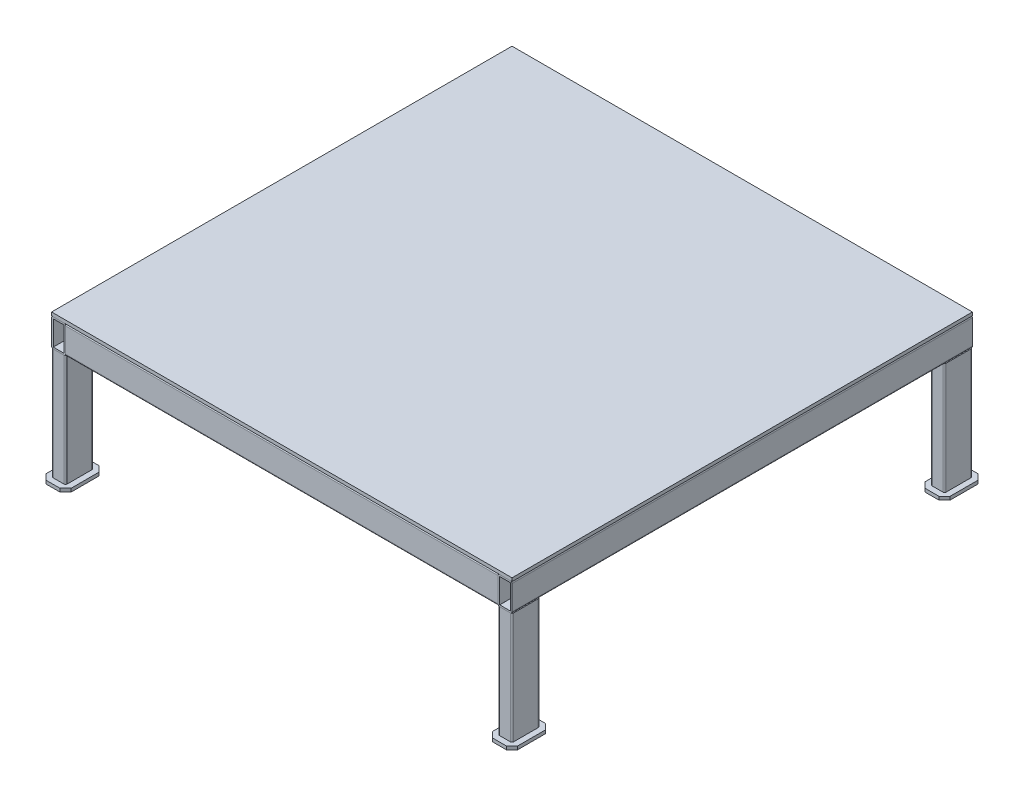
from build123d import *

# Parameters (mm, degrees)
F_50_START              = -387.5
F_50_X_25_X_3_1_DEPTH   = 775
F_50_START_2            = -412.5
F_50_X_25_X_3_1_2_DEPTH = 825
F_50_X_25_X_3_1_3_DEPTH = 825
F_50_X_25_X_3_1_4_DEPTH = 775
F_50_X_25_X_3_1_5_DEPTH = 775
F_50_X_25_X_3_6_DEPTH   = 200
SKETCH_5_W              = 825
SKETCH_5_H              = 825
EXTRUDE_1_DEPTH         = 6
SKETCH_6_W              = 45
SKETCH_6_H              = 70
EXTRUDE_2_DEPTH         = 6
CHAMFER_1_SIZE          = 10


with BuildPart() as part:
    # Прямоугольная труба 50 X 25 X 3(1): read off the stored shape, not the designer's step
    # Прямоугольная труба 50 X 25 X 3(1) outline → Прямоугольная труба 50 X 25 X 3(1) (new body)
    with BuildSketch(Plane.YZ.offset(F_50_START)):
        with BuildLine():
            ThreePointArc((21.99, 387.5), (24.118391411, 388.381608589), (25, 390.51))
            Line((25, 390.51), (25, 409.49))
            ThreePointArc((25, 409.49), (24.118391411, 411.618391411), (21.99, 412.5))
            Line((21.99, 412.5), (-21.99, 412.5))
            ThreePointArc((-21.99, 412.5), (-24.118391411, 411.618391411), (-25, 409.49))
            Line((-25, 409.49), (-25, 390.51))
            ThreePointArc((-25, 390.51), (-24.118391411, 388.381608589), (-21.99, 387.5))
            Line((-21.99, 387.5), (21.99, 387.5))
        make_face()
        with BuildLine():
            Line((-21.99, 409.5), (21.99, 409.5))
            ThreePointArc((21.99, 409.5), (21.997071068, 409.497071068), (22, 409.49))
            Line((22, 409.49), (22, 390.51))
            ThreePointArc((22, 390.51), (21.997071068, 390.502928932), (21.99, 390.5))
            Line((21.99, 390.5), (-21.99, 390.5))
            ThreePointArc((-21.99, 390.5), (-21.997071068, 390.502928932), (-22, 390.51))
            Line((-22, 390.51), (-22, 409.49))
            ThreePointArc((-22, 409.49), (-21.997071068, 409.497071068), (-21.99, 409.5))
        make_face(mode=Mode.SUBTRACT)
    extrude(amount=F_50_X_25_X_3_1_DEPTH)


with BuildPart() as body_2:
    # 50 X 25 X 3_1 2 outline → 50 X 25 X 3_1 2 (new body)
    with BuildSketch(Plane.XY.offset(F_50_START_2)):
        with BuildLine():
            ThreePointArc((-387.5, 21.99), (-388.381608589, 24.118391411), (-390.51, 25))
            Line((-390.51, 25), (-409.49, 25))
            ThreePointArc((-409.49, 25), (-411.618391411, 24.118391411), (-412.5, 21.99))
            Line((-412.5, 21.99), (-412.5, -21.99))
            ThreePointArc((-412.5, -21.99), (-411.618391411, -24.118391411), (-409.49, -25))
            Line((-409.49, -25), (-390.51, -25))
            ThreePointArc((-390.51, -25), (-388.381608589, -24.118391411), (-387.5, -21.99))
            Line((-387.5, -21.99), (-387.5, 21.99))
        make_face()
        with BuildLine():
            Line((-409.5, -21.99), (-409.5, 21.99))
            ThreePointArc((-409.5, 21.99), (-409.497071068, 21.997071068), (-409.49, 22))
            Line((-409.49, 22), (-390.51, 22))
            ThreePointArc((-390.51, 22), (-390.502928932, 21.997071068), (-390.5, 21.99))
            Line((-390.5, 21.99), (-390.5, -21.99))
            ThreePointArc((-390.5, -21.99), (-390.502928932, -21.997071068), (-390.51, -22))
            Line((-390.51, -22), (-409.49, -22))
            ThreePointArc((-409.49, -22), (-409.497071068, -21.997071068), (-409.5, -21.99))
        make_face(mode=Mode.SUBTRACT)
    extrude(amount=F_50_X_25_X_3_1_2_DEPTH)


with BuildPart() as body_3:
    # 50 X 25 X 3_1 3 outline → 50 X 25 X 3_1 3 (new body)
    with BuildSketch(Plane.XY.offset(F_50_START_2)):
        with BuildLine():
            Line((409.49, 25), (390.51, 25))
            ThreePointArc((390.51, 25), (388.381608589, 24.118391411), (387.5, 21.99))
            Line((387.5, 21.99), (387.5, -21.99))
            ThreePointArc((387.5, -21.99), (388.381608589, -24.118391411), (390.51, -25))
            Line((390.51, -25), (409.49, -25))
            ThreePointArc((409.49, -25), (411.618391411, -24.118391411), (412.5, -21.99))
            Line((412.5, -21.99), (412.5, 21.99))
            ThreePointArc((412.5, 21.99), (411.618391411, 24.118391411), (409.49, 25))
        make_face()
        with BuildLine():
            ThreePointArc((409.49, 22), (409.497071068, 21.997071068), (409.5, 21.99))
            Line((409.5, 21.99), (409.5, -21.99))
            ThreePointArc((409.5, -21.99), (409.497071068, -21.997071068), (409.49, -22))
            Line((409.49, -22), (390.51, -22))
            ThreePointArc((390.51, -22), (390.502928932, -21.997071068), (390.5, -21.99))
            Line((390.5, -21.99), (390.5, 21.99))
            ThreePointArc((390.5, 21.99), (390.502928932, 21.997071068), (390.51, 22))
            Line((390.51, 22), (409.49, 22))
        make_face(mode=Mode.SUBTRACT)
    extrude(amount=F_50_X_25_X_3_1_3_DEPTH)


with BuildPart() as body_4:
    # 50 X 25 X 3_1 4 outline → 50 X 25 X 3_1 4 (new body)
    with BuildSketch(Plane.YZ.offset(F_50_START)):
        with BuildLine():
            Line((25, -409.49), (25, -390.51))
            ThreePointArc((25, -390.51), (24.118391411, -388.381608589), (21.99, -387.5))
            Line((21.99, -387.5), (-21.99, -387.5))
            ThreePointArc((-21.99, -387.5), (-24.118391411, -388.381608589), (-25, -390.51))
            Line((-25, -390.51), (-25, -409.49))
            ThreePointArc((-25, -409.49), (-24.118391411, -411.618391411), (-21.99, -412.5))
            Line((-21.99, -412.5), (21.99, -412.5))
            ThreePointArc((21.99, -412.5), (24.118391411, -411.618391411), (25, -409.49))
        make_face()
        with BuildLine():
            ThreePointArc((22, -409.49), (21.997071068, -409.497071068), (21.99, -409.5))
            Line((21.99, -409.5), (-21.99, -409.5))
            ThreePointArc((-21.99, -409.5), (-21.997071068, -409.497071068), (-22, -409.49))
            Line((-22, -409.49), (-22, -390.51))
            ThreePointArc((-22, -390.51), (-21.997071068, -390.502928932), (-21.99, -390.5))
            Line((-21.99, -390.5), (21.99, -390.5))
            ThreePointArc((21.99, -390.5), (21.997071068, -390.502928932), (22, -390.51))
            Line((22, -390.51), (22, -409.49))
        make_face(mode=Mode.SUBTRACT)
    extrude(amount=F_50_X_25_X_3_1_4_DEPTH)


with BuildPart() as body_5:
    # 50 X 25 X 3_1 5 outline → 50 X 25 X 3_1 5 (new body)
    with BuildSketch(Plane.XY.offset(F_50_START)):
        with BuildLine():
            Line((9.49, 25), (-9.49, 25))
            ThreePointArc((-9.49, 25), (-11.618391411, 24.118391411), (-12.5, 21.99))
            Line((-12.5, 21.99), (-12.5, -21.99))
            ThreePointArc((-12.5, -21.99), (-11.618391411, -24.118391411), (-9.49, -25))
            Line((-9.49, -25), (9.49, -25))
            ThreePointArc((9.49, -25), (11.618391411, -24.118391411), (12.5, -21.99))
            Line((12.5, -21.99), (12.5, 21.99))
            ThreePointArc((12.5, 21.99), (11.618391411, 24.118391411), (9.49, 25))
        make_face()
        with BuildLine():
            ThreePointArc((9.49, 22), (9.497071068, 21.997071068), (9.5, 21.99))
            Line((9.5, 21.99), (9.5, -21.99))
            ThreePointArc((9.5, -21.99), (9.497071068, -21.997071068), (9.49, -22))
            Line((9.49, -22), (-9.49, -22))
            ThreePointArc((-9.49, -22), (-9.497071068, -21.997071068), (-9.5, -21.99))
            Line((-9.5, -21.99), (-9.5, 21.99))
            ThreePointArc((-9.5, 21.99), (-9.497071068, 21.997071068), (-9.49, 22))
            Line((-9.49, 22), (9.49, 22))
        make_face(mode=Mode.SUBTRACT)
    extrude(amount=F_50_X_25_X_3_1_5_DEPTH)


with BuildPart() as body_6:
    # Sketch12 → Прямоугольная труба 50 X 25 X 3(6) (new body)
    with BuildSketch(Plane(origin=(-400, 0, 400), x_dir=(1, 0, 0), z_dir=(0, -1, 0))):
        with BuildLine():
            Line((-9.49, -25), (9.49, -25))
            ThreePointArc((9.49, -25), (11.618391411, -24.118391411), (12.5, -21.99))
            Line((12.5, -21.99), (12.5, 21.99))
            ThreePointArc((12.5, 21.99), (11.618391411, 24.118391411), (9.49, 25))
            Line((9.49, 25), (-9.49, 25))
            ThreePointArc((-9.49, 25), (-11.618391411, 24.118391411), (-12.5, 21.99))
            Line((-12.5, 21.99), (-12.5, -21.99))
            ThreePointArc((-12.5, -21.99), (-11.618391411, -24.118391411), (-9.49, -25))
        make_face()
        with BuildLine():
            Line((-9.49, -22), (9.49, -22))
            ThreePointArc((9.49, -22), (9.497071068, -21.997071068), (9.5, -21.99))
            Line((9.5, -21.99), (9.5, 21.99))
            ThreePointArc((9.5, 21.99), (9.497071068, 21.997071068), (9.49, 22))
            Line((9.49, 22), (-9.49, 22))
            ThreePointArc((-9.49, 22), (-9.497071068, 21.997071068), (-9.5, 21.99))
            Line((-9.5, 21.99), (-9.5, -21.99))
            ThreePointArc((-9.5, -21.99), (-9.497071068, -21.997071068), (-9.49, -22))
        make_face(mode=Mode.SUBTRACT)
    extrude(amount=F_50_X_25_X_3_6_DEPTH)


with BuildPart() as body_6_1:
    # Move Body 1: read off the stored shape, not the designer's step
    # Move Body 1: moved
    add(body_6.part.moved(Location((0, -25, -12.5))))


with BuildPart() as body_7:
    # Эскиз5 → Бобышка-Вытянуть1 (new body)
    with BuildSketch(Plane(origin=(0, 25, 0), x_dir=(1, 0, 0), z_dir=(0, 1, 0))):
        Rectangle(SKETCH_5_W, SKETCH_5_H)
    extrude(amount=EXTRUDE_1_DEPTH)


with BuildPart() as body_8:
    # Эскиз6 → Бобышка-Вытянуть2 (new body)
    with BuildSketch(Plane.XZ.offset(225)):
        with Locations((-400, 387.5)):
            Rectangle(SKETCH_6_W, SKETCH_6_H)
    extrude(amount=EXTRUDE_2_DEPTH)

    # Фаска1
    chamfer_1_edges = [body_8.edges().sort_by_distance(p)[0] for p in [
        (-377.5, -228, 352.5),
        (-422.5, -228, 352.5),
        (-422.5, -228, 422.5),
        (-377.5, -228, 422.5),
    ]]
    chamfer(chamfer_1_edges, length=CHAMFER_1_SIZE)


with BuildPart() as body_9:
    # Зеркальное отражение1: mirrored copy
    add(body_6_1.part.mirror(Plane.XY))


with BuildPart() as body_10:
    # Mirror 1 2: mirrored copy
    add(body_8.part.mirror(Plane.XY))


with BuildPart() as body_11:
    # Зеркальное отражение2: mirrored copy
    add(body_6_1.part.mirror(Plane(origin=(0, 0, 0), x_dir=(0, 0, 1), z_dir=(1, 0, 0))))


with BuildPart() as body_12:
    # Mirror 2 2: mirrored copy
    add(body_9.part.mirror(Plane(origin=(0, 0, 0), x_dir=(0, 0, 1), z_dir=(1, 0, 0))))


with BuildPart() as body_13:
    # Mirror 2 3: mirrored copy
    add(body_8.part.mirror(Plane(origin=(0, 0, 0), x_dir=(0, 0, 1), z_dir=(1, 0, 0))))


with BuildPart() as body_14:
    # Mirror 2 4: mirrored copy
    add(body_10.part.mirror(Plane(origin=(0, 0, 0), x_dir=(0, 0, 1), z_dir=(1, 0, 0))))


solid = Compound([part.part, body_2.part, body_3.part, body_4.part, body_5.part, body_6_1.part, body_7.part, body_8.part, body_9.part, body_10.part, body_11.part, body_12.part, body_13.part, body_14.part])
